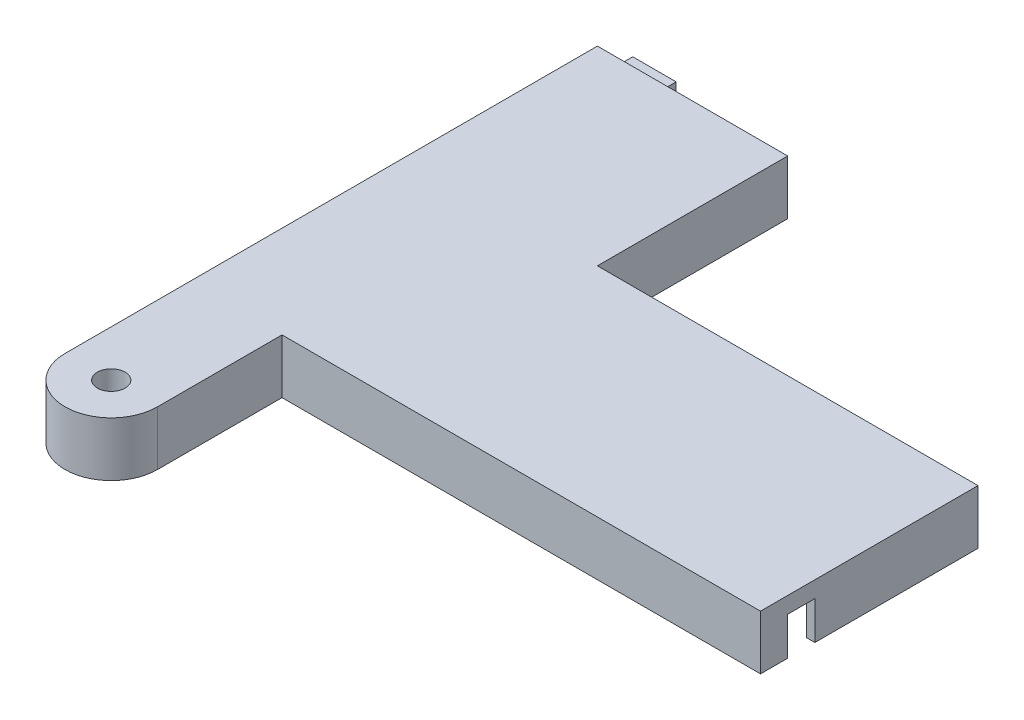
from build123d import *

# Parameters (mm, degrees)
CORNERBOSS_EXTRUDE1_DEPTH               = 20
SHELL4_T                                = -3
PADSKETCH2_R                            = 12
PADBOSS_EXTRUDE2_DEPTH                  = 10
STEPPERSHAFTHOLECUTSKETCH3_R            = 5.1
STEPPERSHAFTHOLECUT_EXTRUDE1_DEPTH      = 288.430740571
THREADEDNUTMOUNTHOLESSKETCH4_R          = 1
THREADEDNUTMOUNTHOLESCUT_EXTRUDE2_DEPTH = 10
BRPEGHOLESKETCH1_W                      = 10
BRPEGHOLESKETCH1_H                      = 14
BRPEGHOLECUT_EXTRUDE1_DEPTH             = 3
TOPPEGSKETCH2_W                         = 9.8
TOPPEGSKETCH2_H                         = 13.9
TOPPEGBOSS_EXTRUDE1_DEPTH               = 3
TOPPEGCAPSKETCH3_W                      = 16
TOPPEGCAPSKETCH3_H                      = 17
TOPPEGCAPBOSS_EXTRUDE2_DEPTH            = 3.1
CENTERPEGHOLECUTSKETCH1_W               = 10
CENTERPEGHOLECUTSKETCH1_H               = 14
CENTERPEGHOLECUT_EXTRUDE1_DEPTH         = 3


with BuildPart() as part:
    # CornerrSketch1 → CornerBoss-Extrude1 (new body)
    with BuildSketch(Plane(origin=(0, 0, 0), x_dir=(1, 0, 0), z_dir=(0, 1, 0))):
        with BuildLine():
            Line((0, 195.825), (70, 195.825))
            Line((70, 195.825), (70, 125.825))
            Line((70, 125.825), (210, 125.825))
            Line((210, 125.825), (210, 45.825))
            Line((210, 45.825), (34, 45.825))
            Line((34, 45.825), (34, 0))
            ThreePointArc((34, 0), (17, -17), (0, 0))
            Line((0, 0), (0, 195.825))
        make_face()
    extrude(amount=CORNERBOSS_EXTRUDE1_DEPTH)

    # Shell4
    shell4_openings = [part.faces().sort_by_distance(p)[0] for p in [
        (83.067785517, 0, -95.408443826),
    ]]
    offset(amount=SHELL4_T, openings=shell4_openings, kind=Kind.INTERSECTION)

    # PadSketch2 → PadBoss-Extrude2 (add)
    with BuildSketch(Plane.XZ.offset(-17)):
        with Locations((17, 0)):
            Circle(PADSKETCH2_R)
    extrude(amount=PADBOSS_EXTRUDE2_DEPTH)

    # StepperShaftHoleCutSketch3 → StepperShaftHoleCut-Extrude1 (cut, through all)
    with BuildSketch(Plane.XZ.offset(-7)):
        with Locations((17, 0)):
            Circle(STEPPERSHAFTHOLECUTSKETCH3_R)
    extrude(amount=-STEPPERSHAFTHOLECUT_EXTRUDE1_DEPTH, mode=Mode.SUBTRACT)

    # ThreadedNutMountHolesSketch4 → ThreadedNutMountHolesCut-Extrude2 (cut)
    with BuildSketch(Plane(origin=(0, 7, 0), x_dir=(-1, 0, 0), z_dir=(0, -1, 0))):
        with Locations((-17, 8)):
            Circle(THREADEDNUTMOUNTHOLESSKETCH4_R)
        with Locations((-17, -8)):
            Circle(THREADEDNUTMOUNTHOLESSKETCH4_R)
        with Locations((-25, 0)):
            Circle(THREADEDNUTMOUNTHOLESSKETCH4_R)
        with Locations((-9, 0)):
            Circle(THREADEDNUTMOUNTHOLESSKETCH4_R)
    extrude(amount=-THREADEDNUTMOUNTHOLESCUT_EXTRUDE2_DEPTH, mode=Mode.SUBTRACT)

    # BRPegHoleSketch1 → BRPegHoleCut-Extrude1 (cut)
    with BuildSketch(Plane(origin=(210, 0, 0), x_dir=(0, 0, -1), z_dir=(1, 0, 0))):
        with Locations((60.825, 7)):
            Rectangle(BRPEGHOLESKETCH1_W, BRPEGHOLESKETCH1_H)
    extrude(amount=-BRPEGHOLECUT_EXTRUDE1_DEPTH, mode=Mode.SUBTRACT)

    # TopPegSketch2 → TopPegBoss-Extrude1 (add)
    with BuildSketch(Plane(origin=(0, 0, -195.825), x_dir=(-1, 0, 0), z_dir=(0, 0, -1))):
        with Locations((-15, 6.95)):
            Rectangle(TOPPEGSKETCH2_W, TOPPEGSKETCH2_H)
    extrude(amount=TOPPEGBOSS_EXTRUDE1_DEPTH)

    # TopPegCapSketch3 → TopPegCapBoss-Extrude2 (add)
    with BuildSketch(Plane(origin=(0, 0, -198.825), x_dir=(-1, 0, 0), z_dir=(0, 0, -1))):
        with Locations((-14.9, 8.5)):
            Rectangle(TOPPEGCAPSKETCH3_W, TOPPEGCAPSKETCH3_H)
    extrude(amount=TOPPEGCAPBOSS_EXTRUDE2_DEPTH)

    # CenterPegHoleCutSketch1 → CenterPegHoleCut-Extrude1 (cut)
    with BuildSketch(Plane(origin=(0, 0, -125.825), x_dir=(-1, 0, 0), z_dir=(0, 0, -1))):
        with Locations((-175, 7)):
            Rectangle(CENTERPEGHOLECUTSKETCH1_W, CENTERPEGHOLECUTSKETCH1_H)
    extrude(amount=-CENTERPEGHOLECUT_EXTRUDE1_DEPTH, mode=Mode.SUBTRACT)


solid = part.part
